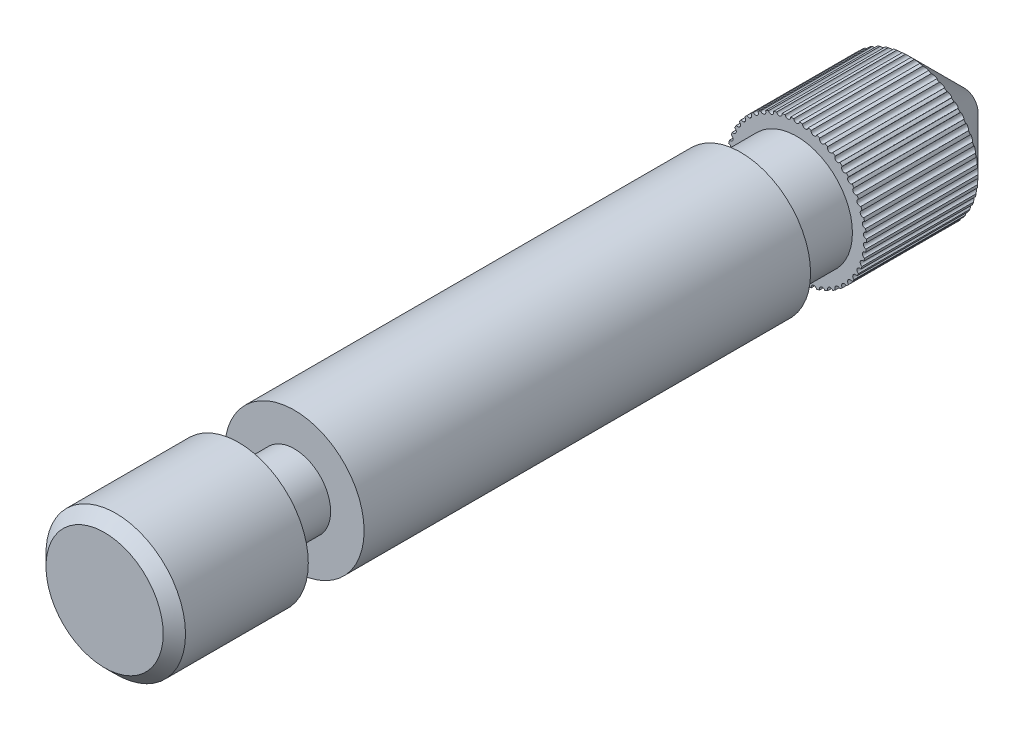
from build123d import *

# Parameters (mm, degrees)
SKETCH1_R           = 1.25
BOSS_EXTRUDE1_DEPTH = 15.4
SKETCH2_W           = 1
SKETCH2_H           = 0.6
SKETCH3_W           = 1
SKETCH3_H           = 0.25
CHAMFER1_SIZE       = 1
CHAMFER2_SIZE       = 0.2
CUT_EXTRUDE2_REACH  = 14.525
SKETCH4_R           = 0.05
CIRPATTERN2_COUNT   = 50


with BuildPart() as part:
    # Sketch1 → Boss-Extrude1 (new body)
    with BuildSketch(Plane.XY):
        Circle(SKETCH1_R)
    extrude(amount=-BOSS_EXTRUDE1_DEPTH)

    # Sketch2 → Cut-Revolve1 (revolve, cut)
    with BuildSketch(Plane(origin=(0, 0, 0), x_dir=(0, 0, -1), z_dir=(1, 0, 0))):
        with Locations((2.9, 0.95)):
            Rectangle(SKETCH2_W, SKETCH2_H)
    revolve(axis=Axis((0, 0, 0), (0, 0, -1)), mode=Mode.SUBTRACT)

    # Sketch3 → Cut-Revolve2 (revolve, cut)
    with BuildSketch(Plane(origin=(0, 0, 0), x_dir=(0, 0, -1), z_dir=(1, 0, 0))):
        with Locations((11.9, 1.125)):
            Rectangle(SKETCH3_W, SKETCH3_H)
    revolve(axis=Axis((0, 0, 0), (0, 0, -1)), mode=Mode.SUBTRACT)

    # Chamfer1
    chamfer1_edges = [part.edges().sort_by_distance(p)[0] for p in [
        (-1.25, 0, -15.4),
    ]]
    chamfer(chamfer1_edges, length=CHAMFER1_SIZE)

    # Chamfer2
    chamfer2_edges = [part.edges().sort_by_distance(p)[0] for p in [
        (-1.25, 0, 0),
    ]]
    chamfer(chamfer2_edges, length=CHAMFER2_SIZE)

    # Sketch4 → Cut-Extrude2 (cut, up to next)
    with BuildSketch(Plane.XY.offset(-12.4), mode=Mode.PRIVATE) as cut_extrude2_sk1:
        with Locations((0, 1.25)):
            Circle(SKETCH4_R)
    cut_extrude2_tool1 = extrude(cut_extrude2_sk1.sketch, amount=-CUT_EXTRUDE2_REACH, mode=Mode.PRIVATE) & part.part
    cut_extrude2 = cut_extrude2_tool1.solids().sort_by_distance((0, 1.25, -12.4))[0]
    add(cut_extrude2, mode=Mode.SUBTRACT)

    # CirPattern2: Cut-Extrude2 ×50 about axis
    cirpattern2_axis = Axis((0, 0, -15.4), (0, 0, 1))
    for i in range(1, CIRPATTERN2_COUNT):
        add(cut_extrude2.rotate(cirpattern2_axis, i * 360 / CIRPATTERN2_COUNT), mode=Mode.SUBTRACT)


solid = part.part
